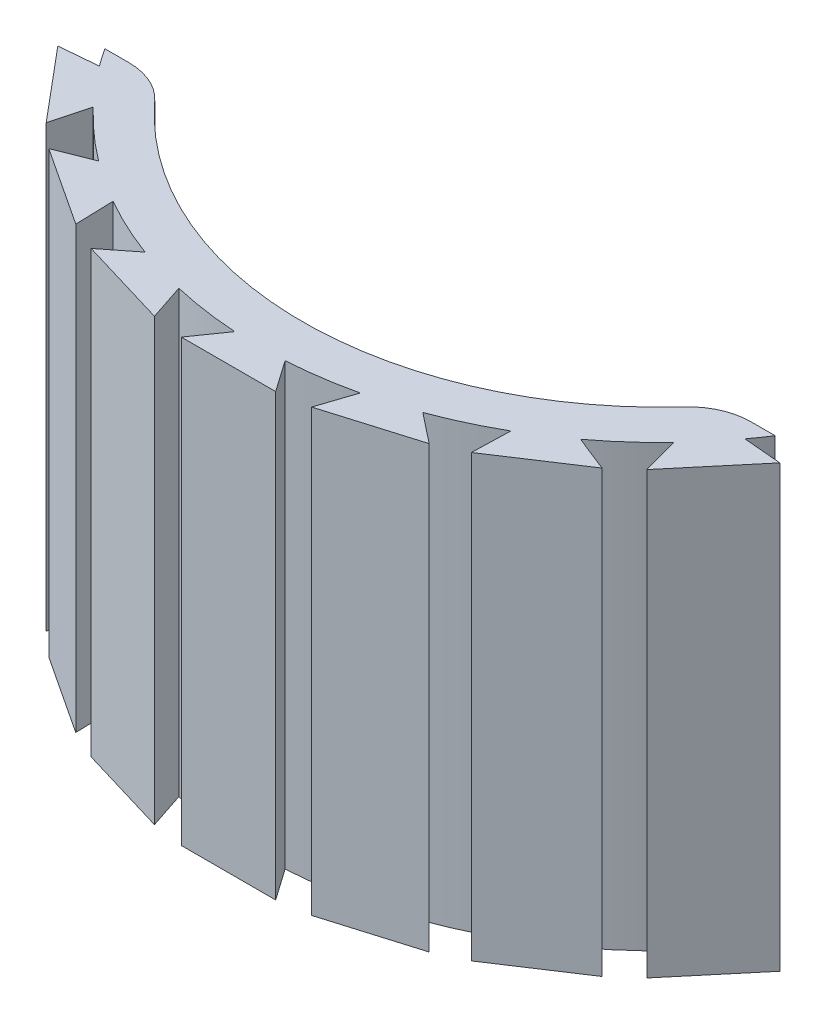
from build123d import *

# Parameters (mm, degrees)
BOSS_EXTRUDE1_DEPTH = 35.56
CAVITY1_DEPTH       = 35.56
FILLET1_R           = 5.08


# Read off the part's stored shape, not the designer's step: Cavity1
with BuildPart() as part:
    # Sketch1 → Boss-Extrude1 (new body)
    with BuildSketch(Plane(origin=(0, 0, 0), x_dir=(1, 0, 0), z_dir=(0, 1, 0))):
        with BuildLine():
            Line((-31.526966632, -17.78), (-22.773848077, -17.78))
            ThreePointArc((-22.773848077, -17.78), (0, -28.8925), (22.773848077, -17.78))
            Line((22.773848077, -17.78), (31.526966632, -17.78))
            ThreePointArc((31.526966632, -17.78), (0, -36.195), (-31.526966632, -17.78))
        make_face()
    extrude(amount=BOSS_EXTRUDE1_DEPTH)

    # Cavity1 outline → Cavity1 (cut)
    with BuildSketch(Plane(origin=(0, 0, 0), x_dir=(1, 0, 0), z_dir=(0, 1, 0))):
        with BuildLine():
            Line((31.526966632, -17.78), (27.067689687, -17.78))
            ThreePointArc((27.067689687, -17.78), (26.576241445, -18.506529001), (26.065297512, -19.219482059))
            Line((26.065297512, -19.219482059), (29.154265611, -19.489731749))
            Line((29.154265611, -19.489731749), (24.256224025, -25.326990406))
            Line((24.256224025, -25.326990406), (23.453686354, -22.331879039))
            ThreePointArc((23.453686354, -22.331879039), (21.529414108, -24.192406932), (19.458072067, -25.887673832))
            Line((19.458072067, -25.887673832), (22.339762624, -27.032496238))
            Line((22.339762624, -27.032496238), (15.973345502, -31.219754651))
            Line((15.973345502, -31.219754651), (16.063530451, -28.120298975))
            ThreePointArc((16.063530451, -28.120298975), (13.686492406, -29.350777683), (11.215960427, -30.380758001))
            Line((11.215960427, -30.380758001), (13.648250992, -32.303964027))
            Line((13.648250992, -32.303964027), (6.348370909, -34.48940466))
            Line((6.348370909, -34.48940466), (7.323701052, -31.546023963))
            ThreePointArc((7.323701052, -31.546023963), (4.693618264, -32.043067465), (2.031472853, -32.321221249))
            Line((2.031472853, -32.321221249), (3.81, -34.861221249))
            Line((3.81, -34.861221249), (-3.81, -34.861221249))
            Line((-3.81, -34.861221249), (-2.031472853, -32.321221249))
            ThreePointArc((-2.031472853, -32.321221249), (-4.693618264, -32.043067465), (-7.323701052, -31.546023963))
            Line((-7.323701052, -31.546023963), (-6.348370909, -34.48940466))
            Line((-6.348370909, -34.48940466), (-13.648250992, -32.303964027))
            Line((-13.648250992, -32.303964027), (-11.215960427, -30.380758001))
            ThreePointArc((-11.215960427, -30.380758001), (-13.686492406, -29.350777683), (-16.063530451, -28.120298975))
            Line((-16.063530451, -28.120298975), (-15.973345502, -31.219754651))
            Line((-15.973345502, -31.219754651), (-22.339762624, -27.032496238))
            Line((-22.339762624, -27.032496238), (-19.458072067, -25.887673832))
            ThreePointArc((-19.458072067, -25.887673832), (-21.529414108, -24.192406932), (-23.453686354, -22.331879039))
            Line((-23.453686354, -22.331879039), (-24.256224025, -25.326990406))
            Line((-24.256224025, -25.326990406), (-29.154265611, -19.489731749))
            Line((-29.154265611, -19.489731749), (-26.065297512, -19.219482059))
            ThreePointArc((-26.065297512, -19.219482059), (-26.576241445, -18.506529001), (-27.067689687, -17.78))
            Line((-27.067689687, -17.78), (-31.526966632, -17.78))
            ThreePointArc((-31.526966632, -17.78), (0, -36.195), (31.526966632, -17.78))
        make_face()
    extrude(amount=CAVITY1_DEPTH, mode=Mode.SUBTRACT)

    # Fillet1
    fillet1_edges = [part.edges().sort_by_distance(p)[0] for p in [
        (-22.773848077, 17.78, 17.78),
        (22.773848077, 17.78, 17.78),
    ]]
    fillet(fillet1_edges, radius=FILLET1_R)


solid = part.part
